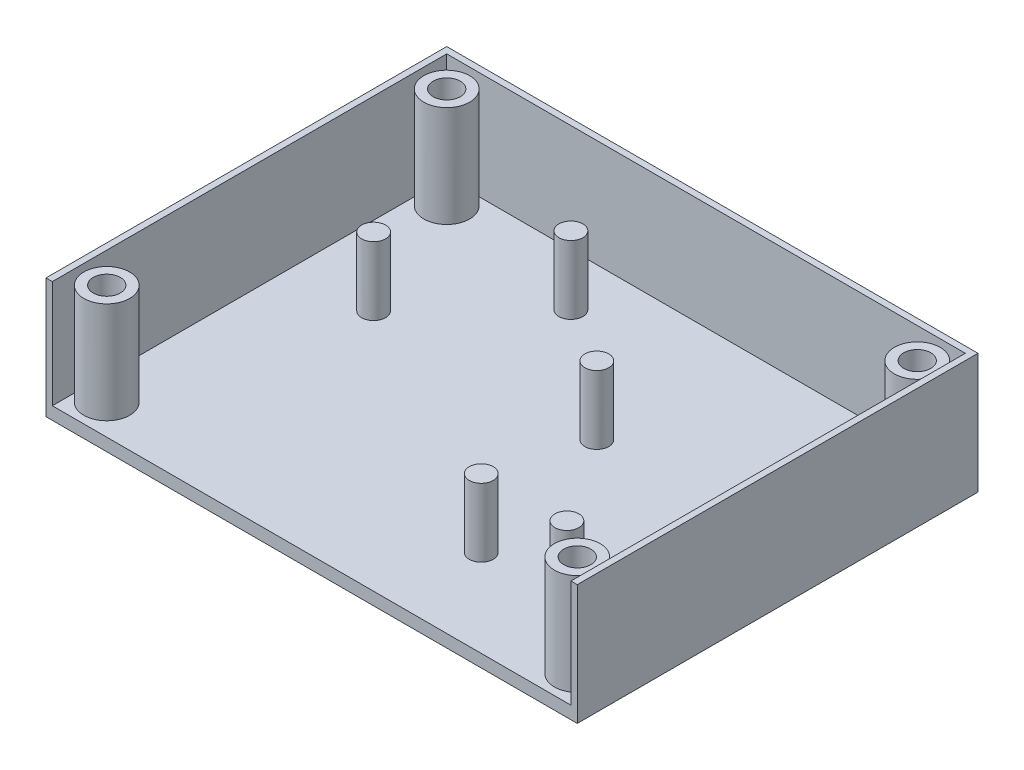
from build123d import *

# Parameters (mm, degrees)
BOSS_EXTRUDE12_DEPTH = 3.175
BOSS_EXTRUDE13_DEPTH = 30.1625
SKETCH1_25_R         = 5.75
SKETCH1_25_R_2       = 3.4
BOSS_EXTRUDE15_DEPTH = 28.575
SKETCH1_27_R         = 3.4
CUT_EXTRUDE3_DEPTH   = 28.575
CHAMFER2_SIZE        = 1.45
SKETCH1_28_R         = 3
BOSS_EXTRUDE16_DEPTH = 20.32


with BuildPart() as part:
    # Sketch1 → Boss-Extrude12 (new body)
    with BuildSketch(Plane(origin=(0, 0, 0), x_dir=(1, 0, 0), z_dir=(0, 1, 0))):
        Polygon((-66.858315384, -50.276221126), (-65.270815384, -50.276221126), (64.85543465, -50.276221126), (66.44293465, -50.276221126), (66.44293465, 50.266274766), (-66.858315384, 50.266274766), align=None)
    extrude(amount=BOSS_EXTRUDE12_DEPTH)

    # Sketch1<23> → Boss-Extrude13 (add)
    with BuildSketch(Plane(origin=(0, 0, 0), x_dir=(1, 0, 0), z_dir=(0, 1, 0))):
        Polygon((-66.858315384, 50.266274766), (-66.858315384, -50.276221126), (-65.270815384, -50.276221126), (-65.270815384, 48.678774766), (64.85543465, 48.678774766), (64.85543465, -50.276221126), (66.44293465, -50.276221126), (66.44293465, 50.266274766), align=None)
    extrude(amount=BOSS_EXTRUDE13_DEPTH)

    # Sketch1<25> → Boss-Extrude15 (add)
    # profile 1 of 4: a face of its own
    with BuildSketch(Plane(origin=(0, 0, 0), x_dir=(1, 0, 0), z_dir=(0, 1, 0))):
        with Locations((-59.238315384, 42.646274766)):
            Circle(SKETCH1_25_R)
        with Locations((-59.238315384, 42.646274766)):
            Circle(SKETCH1_25_R_2, mode=Mode.SUBTRACT)
    # profile 2 of 4: a face of its own
    with BuildSketch(Plane(origin=(0, 0, 0), x_dir=(1, 0, 0), z_dir=(0, 1, 0))):
        with Locations((58.82293465, 42.646274766)):
            Circle(SKETCH1_25_R)
        with Locations((58.82293465, 42.646274766)):
            Circle(SKETCH1_25_R_2, mode=Mode.SUBTRACT)
    # profile 3 of 4: a face of its own
    with BuildSketch(Plane(origin=(0, 0, 0), x_dir=(1, 0, 0), z_dir=(0, 1, 0))):
        with Locations((-59.238315384, -42.656221126)):
            Circle(SKETCH1_25_R)
        with Locations((-59.238315384, -42.656221126)):
            Circle(SKETCH1_25_R_2, mode=Mode.SUBTRACT)
    # profile 4 of 4: a face of its own
    with BuildSketch(Plane(origin=(0, 0, 0), x_dir=(1, 0, 0), z_dir=(0, 1, 0))):
        with Locations((58.82293465, -42.656221126)):
            Circle(SKETCH1_25_R)
        with Locations((58.82293465, -42.656221126)):
            Circle(SKETCH1_25_R_2, mode=Mode.SUBTRACT)
    extrude(amount=BOSS_EXTRUDE15_DEPTH)

    # Sketch1<27> → Cut-Extrude3 (cut)
    with BuildSketch(Plane(origin=(0, 0, 0), x_dir=(1, 0, 0), z_dir=(0, 1, 0))):
        with Locations((-59.238315384, 42.646274766)):
            Circle(SKETCH1_27_R)
        with Locations((58.82293465, 42.646274766)):
            Circle(SKETCH1_27_R)
        with Locations((-59.238315384, -42.656221126)):
            Circle(SKETCH1_27_R)
        with Locations((58.82293465, -42.656221126)):
            Circle(SKETCH1_27_R)
    extrude(amount=CUT_EXTRUDE3_DEPTH, mode=Mode.SUBTRACT)

    # Chamfer2
    chamfer2_edges = [part.edges().sort_by_distance(p)[0] for p in [
        (55.42293465, 0, 42.656221126),
        (55.42293465, 0, -42.646274766),
        (-62.638315384, 0, 42.656221126),
        (-62.638315384, 0, -42.646274766),
    ]]
    chamfer(chamfer2_edges, length=CHAMFER2_SIZE)

    # Sketch1<28> → Boss-Extrude16 (add)
    with BuildSketch(Plane(origin=(0, 0, 0), x_dir=(1, 0, 0), z_dir=(0, 1, 0))):
        with Locations((-21.087205302, 35.652944211)):
            Circle(SKETCH1_28_R)
        with Locations((20.412794756, -28.347055805)):
            Circle(SKETCH1_28_R)
        with Locations((-45.587205324, 10.652944173)):
            Circle(SKETCH1_28_R)
        with Locations((10.41279469, 10.652944173)):
            Circle(SKETCH1_28_R)
        with Locations((41.412794666, -27.847055789)):
            Circle(SKETCH1_28_R)
    extrude(amount=BOSS_EXTRUDE16_DEPTH)


solid = part.part
